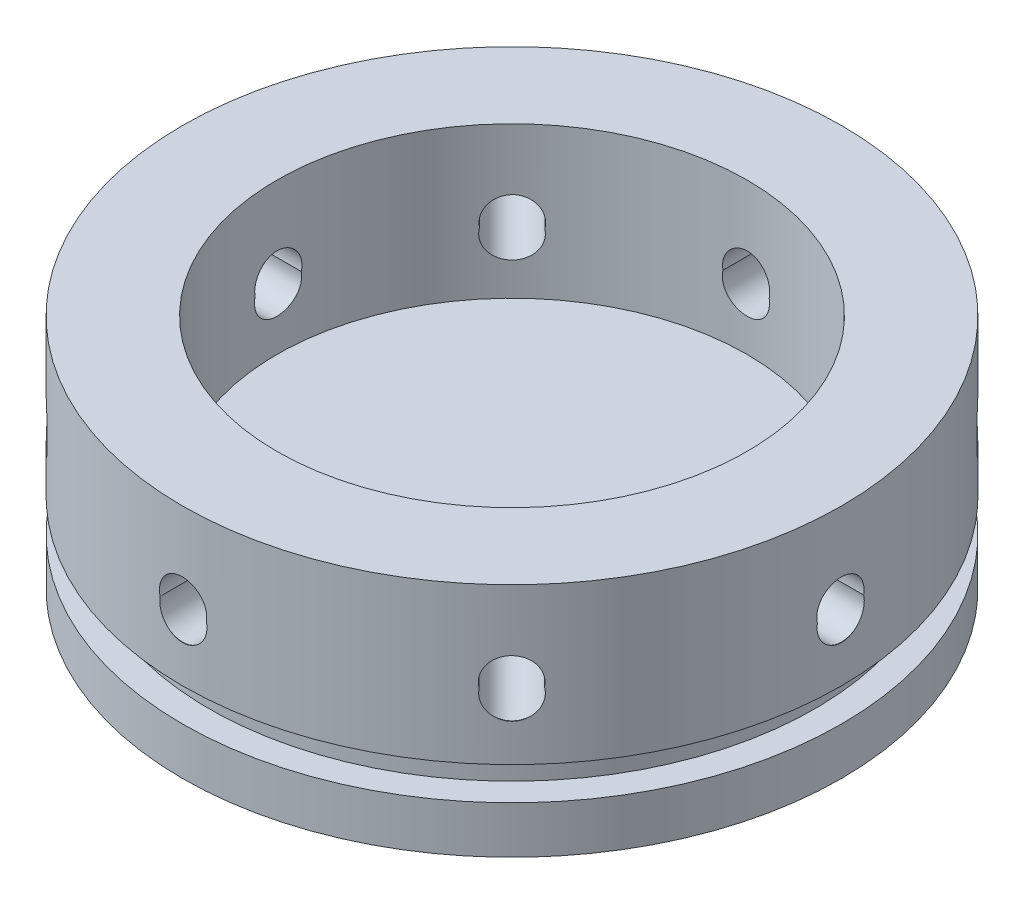
from build123d import *

# Parameters (mm, degrees)
PADR_OCIRCULAR2_COUNT      = 8
CORTE_EXTRUS_O1_REACH      = 83.945
CORTE_EXTRUS_O1_END_RADIUS = 24.9
ESBO_O2_R                  = 2.5
PADR_OCIRCULAR1_COUNT      = 8


# Read off the part's stored shape, not the designer's step: Broca de rosquear para tarraxa de M6x1.01
with BuildPart() as part:
    # Esboço1 → Revolução1 (revolve)
    with BuildSketch(Plane.XY, mode=Mode.PRIVATE) as revolu_o1_sk:
        Polygon((-32.1, 5), (-32.1, 8.5), (-34.9, 8.5), (-34.9, 17.5), (-34.9, 25), (-24.9, 25), (-24.9, 9), (0, 9), (0, 0), (-34.9, 0), (-34.9, 3), (-34.9, 5), align=None)
    revolve(revolu_o1_sk.sketch.rotate(Axis((0, 0, 0), (0, 1, 0)), 270), axis=Axis((0, 0, 0), (0, 1, 0)))

    # Broca de rosquear para tarraxa de M6 2 → Broca de rosquear para tarraxa de M6x1.01 (revolve, cut)
    with BuildSketch(Plane(origin=(0, 15, 0), x_dir=(0, 1, 0), z_dir=(0, 0, -1))):
        Polygon((0, -34.900017593), (2.525017593, -34.900017593), (2.499999938, -34.874999938), (2.5, -24.77411209), (0, -24.77411209), align=None)
    broca_de_rosquear_para_tarraxa_de_m6x1_0 = revolve(axis=Axis((0, 15, 0), (1, 0, 0)), mode=Mode.SUBTRACT)

    # PadrãoCircular2: Broca de rosquear para tarraxa de M6x1.01 ×8 about axis
    padr_ocircular2_axis = Axis((0, 0, 0), (0, 1, 0))
    for i in range(1, PADR_OCIRCULAR2_COUNT):
        add(broca_de_rosquear_para_tarraxa_de_m6x1_0.rotate(padr_ocircular2_axis, i * 360 / PADR_OCIRCULAR2_COUNT), mode=Mode.SUBTRACT)

    # Corte-extrusão1: up to this cylinder (the profile starts outside it)
    corte_extrus_o1_end = Plane(origin=(0, 16, 0), z_dir=(0, -1, 0)) * Cylinder(CORTE_EXTRUS_O1_END_RADIUS, 218.69, mode=Mode.PRIVATE)
    # Esboço2 → Corte-extrusão1 (cut, up to the surface)
    with BuildSketch(Plane.ZY.offset(34.9), mode=Mode.PRIVATE) as corte_extrus_o1_sk1:
        with Locations((-0.026659492, 16)):
            Circle(ESBO_O2_R)
    corte_extrus_o1_tool1 = extrude(corte_extrus_o1_sk1.sketch, amount=-CORTE_EXTRUS_O1_REACH, mode=Mode.PRIVATE) - corte_extrus_o1_end
    corte_extrus_o1 = corte_extrus_o1_tool1.solids().sort_by_distance((-34.9, 16, -0.026659))[0]
    add(corte_extrus_o1, mode=Mode.SUBTRACT)

    # PadrãoCircular1: Corte-extrusão1 ×8 about axis
    padr_ocircular1_axis = Axis((0, 25, 0), (0, -1, 0))
    for i in range(1, PADR_OCIRCULAR1_COUNT):
        add(corte_extrus_o1.rotate(padr_ocircular1_axis, i * 360 / PADR_OCIRCULAR1_COUNT), mode=Mode.SUBTRACT)


solid = part.part
